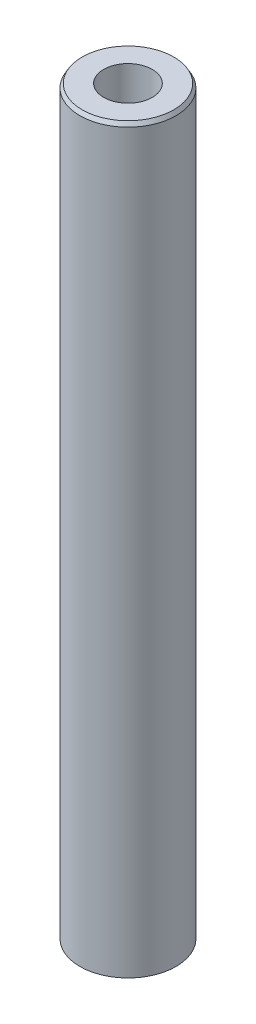
from build123d import *
from OCP.BRepFilletAPI import BRepFilletAPI_MakeChamfer

# Parameters (mm, degrees)
SKETCH1_R           = 32.5
BOSS_EXTRUDE1_DEPTH = 502.301161617
SKETCH2_R           = 16.425311351
CUT_EXTRUDE1_DEPTH  = 505.399600477
CHAMFER1_SIZE       = 2.680314773
CHAMFER1_SIZE2      = 1.547480456


with BuildPart() as part:
    # Sketch1 → Boss-Extrude1 (new body)
    with BuildSketch(Plane(origin=(0, 0, 0), x_dir=(1, 0, 0), z_dir=(0, 1, 0))):
        Circle(SKETCH1_R)
    extrude(amount=BOSS_EXTRUDE1_DEPTH)

    # Sketch2 → Cut-Extrude1 (cut, through all)
    with BuildSketch(Plane(origin=(0, 0, 0), x_dir=(1, 0, 0), z_dir=(0, 1, 0))):
        Circle(SKETCH2_R)
    extrude(amount=CUT_EXTRUDE1_DEPTH, mode=Mode.SUBTRACT)

    # Chamfer1: one chamfer whose edges measure the first distance from different faces: ONE call of the kernel's chamfer builder (chamfer() names one face for all edges)
    chamfer1_edges_1 = [part.edges().sort_by_distance(p)[0] for p in [
        (-32.5, 502.301161617, 0),
    ]]
    chamfer1_side_1 = [part.faces().sort_by_distance(p)[0] for p in [
        (-32.5, 251.150580808, 0),
    ]]
    chamfer1_edges_2 = [part.edges().sort_by_distance(p)[0] for p in [
        (-32.5, 0, 0),
    ]]
    chamfer1_side_2 = [part.faces().sort_by_distance(p)[0] for p in [
        (-31.580761184, 0, 0),
    ]]
    chamfer1 = BRepFilletAPI_MakeChamfer(part.part.solid().wrapped)
    for e in chamfer1_edges_1:
        chamfer1.Add(CHAMFER1_SIZE, CHAMFER1_SIZE2, e.wrapped, chamfer1_side_1[0].wrapped)  # the first distance lies on this face
    for e in chamfer1_edges_2:
        chamfer1.Add(CHAMFER1_SIZE, CHAMFER1_SIZE2, e.wrapped, chamfer1_side_2[0].wrapped)  # the first distance lies on this face
    add(Compound.cast(chamfer1.Shape()), mode=Mode.REPLACE)


solid = part.part
